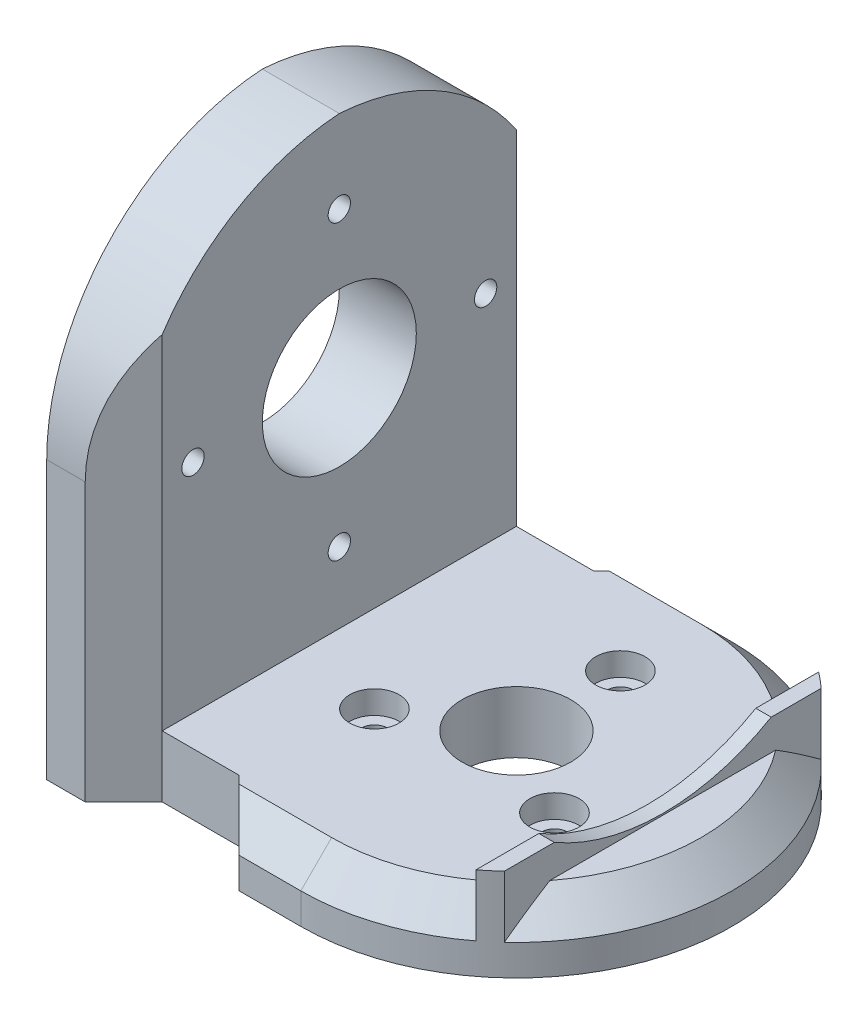
from build123d import *

# Parameters (mm, degrees)
SKETCH_1_R          = 1.7
SKETCH_1_R_2        = 7.046714779
EXTRUDE_2_DEPTH     = 8
SKETCH_2_W          = 10
SKETCH_2_H          = 56
EXTRUDE_3_DEPTH     = 58
SKETCH_3_R          = 1.45
SKETCH_3_R_2        = 10
CUT_EXTRUDE_1_DEPTH = 22
SKETCH_5_W          = 10
SKETCH_5_H          = 20.367119739
CUT_EXTRUDE_3_DEPTH = 18
CHAMFER_1_SIZE      = 5
FILLET_1_R          = 30
SKETCH_6_R          = 3.2
CUT_EXTRUDE_4_DEPTH = 4
SKETCH_7_R          = 3.2
CUT_EXTRUDE_5_DEPTH = 3
EXTRUDE_4_DEPTH     = 4
SKETCH_9_R          = 28
CUT_EXTRUDE_6_DEPTH = 10
CHAMFER_2_SIZE      = 4


# Some blends are built 0.0001 mm under size
with BuildPart() as part:
    # 草图1 → 凸台-拉伸2 (new body)
    with BuildSketch(Plane(origin=(0, 0, 0), x_dir=(1, 0, 0), z_dir=(0, 1, 0))):
        with BuildLine():
            Line((-23, 28), (-33, 28))
            Line((-33, 28), (-33, -28))
            Line((-33, -28), (-23, -28))
            Line((-23, -28), (0, -28))
            ThreePointArc((0, -28), (28, 0), (0, 28))
            Line((0, 28), (-23, 28))
        make_face()
        with Locations(Location((0, 13.5, 0), (0, 0, 270))):
            Circle(SKETCH_1_R, mode=Mode.SUBTRACT)
        with Locations(Location((11.691342951, -6.75, 0), (0, 0, 270))):
            Circle(SKETCH_1_R, mode=Mode.SUBTRACT)
        with Locations(Location((-11.691342951, -6.75, 0), (0, 0, 270))):
            Circle(SKETCH_1_R, mode=Mode.SUBTRACT)
        with Locations(Location((0, 0, 0), (0, 0, 270))):
            Circle(SKETCH_1_R_2, mode=Mode.SUBTRACT)
    extrude(amount=EXTRUDE_2_DEPTH)

    # 草图2 → 凸台-拉伸3 (add)
    with BuildSketch(Plane(origin=(0, 8, 0), x_dir=(1, 0, 0), z_dir=(0, 1, 0))):
        with Locations((-28, 0)):
            Rectangle(SKETCH_2_W, SKETCH_2_H)
    extrude(amount=EXTRUDE_3_DEPTH)

    # 草图3 → 切除-拉伸1 (cut)
    with BuildSketch(Plane(origin=(-23, 0, 0), x_dir=(0, 0, -1), z_dir=(1, 0, 0))):
        with Locations((0, 55.2)):
            Circle(SKETCH_3_R)
        with Locations((19, 36.2)):
            Circle(SKETCH_3_R)
        with Locations((0, 17.2)):
            Circle(SKETCH_3_R)
        with Locations((-19, 36.2)):
            Circle(SKETCH_3_R)
        with Locations((0, 36.2)):
            Circle(SKETCH_3_R_2)
    extrude(amount=-CUT_EXTRUDE_1_DEPTH, mode=Mode.SUBTRACT)

    # 草图5 → 切除-拉伸3 (cut)
    with BuildSketch(Plane(origin=(0, 8, 0), x_dir=(1, 0, 0), z_dir=(0, 1, 0))):
        with Locations((-18, 33.18355987)):
            Rectangle(SKETCH_5_W, SKETCH_5_H)
        with Locations((-18, -33.18355987)):
            Rectangle(SKETCH_5_W, SKETCH_5_H)
    extrude(amount=-CUT_EXTRUDE_3_DEPTH, mode=Mode.SUBTRACT)

    # 倒角1
    chamfer_1_edges = [part.edges().sort_by_distance(p)[0] for p in [
        (-23, 33, 28),
        (-23, 33, -28),
        (-13, 4, -28),
        (-13, 4, 28),
    ]]
    chamfer(chamfer_1_edges, length=CHAMFER_1_SIZE - 0.0001)  # a hair under: the kernel refuses the full size

    # 圆角1
    # the kernel refuses this fillet: 30 mm, written as the material it takes off along each edge
    with BuildSketch(Plane(origin=(-108, 66, -28), x_dir=(0, -1, 0), z_dir=(1, 0, 0)), Plane(origin=(47.0001, 66, 28), x_dir=(0, -1, 0), z_dir=(-1, 0, 0))) as fillet_1_piece_1:
        with BuildLine():
            CenterArc((FILLET_1_R, -FILLET_1_R), FILLET_1_R, 90, 90)
            Line((0, -FILLET_1_R), (0, 0))
            Line((0, 0), (FILLET_1_R, 0))
        make_face()
    extrude(amount=155.0001, mode=Mode.SUBTRACT)

    # 草图6 → 切除-拉伸4 (cut)
    with BuildSketch(Plane.ZY.offset(33)):
        with Locations((-19, 36.2)):
            Circle(SKETCH_6_R)
        with Locations((0, 55.2)):
            Circle(SKETCH_6_R)
        with Locations((19, 36.2)):
            Circle(SKETCH_6_R)
        with Locations((0, 17.2)):
            Circle(SKETCH_6_R)
    extrude(amount=-CUT_EXTRUDE_4_DEPTH, mode=Mode.SUBTRACT)

    # 草图7 → 切除-拉伸5 (cut)
    with BuildSketch(Plane(origin=(0, 8, 0), x_dir=(1, 0, 0), z_dir=(0, 1, 0))):
        with Locations(Location((0, 13.5, 0), (0, 0, 270))):
            Circle(SKETCH_7_R)
        with Locations(Location((11.691342951, -6.75, 0), (0, 0, 270))):
            Circle(SKETCH_7_R)
        with Locations(Location((-11.691342951, -6.75, 0), (0, 0, 270))):
            Circle(SKETCH_7_R)
    extrude(amount=-CUT_EXTRUDE_5_DEPTH, mode=Mode.SUBTRACT)

    # 草图8 → 凸台-拉伸4 (add)
    with BuildSketch(Plane(origin=(0, 8, 0), x_dir=(1, 0, 0), z_dir=(0, 1, 0))):
        with BuildLine():
            Line((17, -22.248595461), (17, 22.248595461))
            ThreePointArc((17, 22.248595461), (18.01962739, 21.4311229), (19, 20.566963801))
            Line((19, 20.566963801), (19, -20.566963801))
            ThreePointArc((19, -20.566963801), (18.01962739, -21.4311229), (17, -22.248595461))
        make_face()
    extrude(amount=EXTRUDE_4_DEPTH)

    # 草图9 → 切除-拉伸6 (cut)
    with BuildSketch(Plane(origin=(19, 0, 0), x_dir=(0, 0, -1), z_dir=(1, 0, 0))):
        with Locations((0, 36.2)):
            Circle(SKETCH_9_R)
    extrude(amount=-CUT_EXTRUDE_6_DEPTH, mode=Mode.SUBTRACT)

    # 倒角2
    # the kernel refuses this chamfer: 4 mm, written as the material it takes off along each edge
    with BuildSketch(Plane(origin=(0, 8, 28), x_dir=(0, 0.027495876610586487, -0.9996219169112968), z_dir=(-1, 0, 0))) as chamfer_2_piece_1:
        Polygon((CHAMFER_2_SIZE * 0.999621916911, CHAMFER_2_SIZE * 0.0274958766106), (-CHAMFER_2_SIZE * 0.0274958766106, CHAMFER_2_SIZE * 0.999621916911), (0, 0), align=None)
    extrude(amount=18.286831952, mode=Mode.SUBTRACT)
    with BuildSketch(Plane(origin=(0, 8, 0), x_dir=(0.369313229341893, 0, 0.9293049761155173), z_dir=(-0.9293049761155173, 0, 0.369313229341893))) as chamfer_2_piece_2_section:
        Polygon((28, -CHAMFER_2_SIZE), (28 - CHAMFER_2_SIZE, 0), (28, 0), align=None)
    chamfer_2_piece_2 = revolve(axis=Axis((0, 8, 0), (0, 1, 0)), revolution_arc=136.653462803, mode=Mode.PRIVATE)
    chamfer_2_piece_2 = split(chamfer_2_piece_2, bisect_by=Plane(origin=(17, 6.694433411, 22.783727906), z_dir=(-1, 0, 0)), keep=Keep.TOP, mode=Mode.PRIVATE)
    add(chamfer_2_piece_2, mode=Mode.SUBTRACT)
    with BuildSketch(Plane(origin=(0, 8, 0), x_dir=(0.369313229341893, 0, 0.9293049761155173), z_dir=(-0.9293049761155173, 0, 0.369313229341893))) as chamfer_2_piece_3_section:
        Polygon((28, -CHAMFER_2_SIZE), (28 - CHAMFER_2_SIZE, 0), (28, 0), align=None)
    chamfer_2_piece_3 = revolve(axis=Axis((0, 8, 0), (0, 1, 0)), revolution_arc=136.653462803, mode=Mode.PRIVATE)
    chamfer_2_piece_3 = split(chamfer_2_piece_3, bisect_by=Plane(origin=(19, 6.048939882, 0), z_dir=(1, 0, 0)), keep=Keep.TOP, mode=Mode.PRIVATE)
    add(chamfer_2_piece_3, mode=Mode.SUBTRACT)
    with BuildSketch(Plane(origin=(0, 8, 0), x_dir=(0.8520392640465919, 0, -0.5234778815985848), z_dir=(0.5234778815985848, 0, 0.8520392640465919))) as chamfer_2_piece_4_section:
        Polygon((28, -CHAMFER_2_SIZE), (28 - CHAMFER_2_SIZE, 0), (28, 0), align=None)
    chamfer_2_piece_4 = revolve(axis=Axis((0, 8, 0), (0, 1, 0)), revolution_arc=58.434168598, mode=Mode.PRIVATE)
    chamfer_2_piece_4 = split(chamfer_2_piece_4, bisect_by=Plane(origin=(19, 6.574014783, -16.582020982), z_dir=(1, 0, 0)), keep=Keep.TOP, mode=Mode.PRIVATE)
    add(chamfer_2_piece_4, mode=Mode.SUBTRACT)
    with BuildSketch(Plane(origin=(0, 8, 0), x_dir=(0.8520392640465919, 0, -0.5234778815985848), z_dir=(0.5234778815985848, 0, 0.8520392640465919))) as chamfer_2_piece_5_section:
        Polygon((28, -CHAMFER_2_SIZE), (28 - CHAMFER_2_SIZE, 0), (28, 0), align=None)
    chamfer_2_piece_5 = revolve(axis=Axis((0, 8, 0), (0, 1, 0)), revolution_arc=58.434168598, mode=Mode.PRIVATE)
    chamfer_2_piece_5 = split(chamfer_2_piece_5, bisect_by=Plane(origin=(17, 6.670131388, -24.579888545), z_dir=(-1, 0, 0)), keep=Keep.TOP, mode=Mode.PRIVATE)
    add(chamfer_2_piece_5, mode=Mode.SUBTRACT)
    with BuildSketch(Plane(origin=(0, 8, 0), x_dir=(0, 0, 1), z_dir=(-1, 0, 0))) as chamfer_2_piece_6_section:
        Polygon((28, -CHAMFER_2_SIZE), (28 - CHAMFER_2_SIZE, 0), (28, 0), align=None)
    chamfer_2_piece_6 = revolve(axis=Axis((0, 8, 0), (0, 1, 0)), revolution_arc=58.434168598, mode=Mode.PRIVATE)
    chamfer_2_piece_6 = split(chamfer_2_piece_6, bisect_by=Plane(origin=(17, 6.670131388, 24.579888545), z_dir=(-1, 0, 0)), keep=Keep.TOP, mode=Mode.PRIVATE)
    add(chamfer_2_piece_6, mode=Mode.SUBTRACT)
    with BuildSketch(Plane(origin=(0, 8, 0), x_dir=(0, 0, 1), z_dir=(-1, 0, 0))) as chamfer_2_piece_7_section:
        Polygon((28, -CHAMFER_2_SIZE), (28 - CHAMFER_2_SIZE, 0), (28, 0), align=None)
    chamfer_2_piece_7 = revolve(axis=Axis((0, 8, 0), (0, 1, 0)), revolution_arc=58.434168598, mode=Mode.PRIVATE)
    chamfer_2_piece_7 = split(chamfer_2_piece_7, bisect_by=Plane(origin=(19, 6.574014783, 16.582020982), z_dir=(1, 0, 0)), keep=Keep.TOP, mode=Mode.PRIVATE)
    add(chamfer_2_piece_7, mode=Mode.SUBTRACT)
    with BuildSketch(Plane(origin=(-18.286831952, 8, -28), x_dir=(0, -0.9996219169112968, -0.027495876610586487), z_dir=(1, 0, 0))) as chamfer_2_piece_8:
        Polygon((CHAMFER_2_SIZE * 0.999621916911, -CHAMFER_2_SIZE * 0.0274958766106), (-CHAMFER_2_SIZE * 0.0274958766106, -CHAMFER_2_SIZE * 0.999621916911), (0, 0), align=None)
    extrude(amount=18.286831952, mode=Mode.SUBTRACT)


solid = part.part
